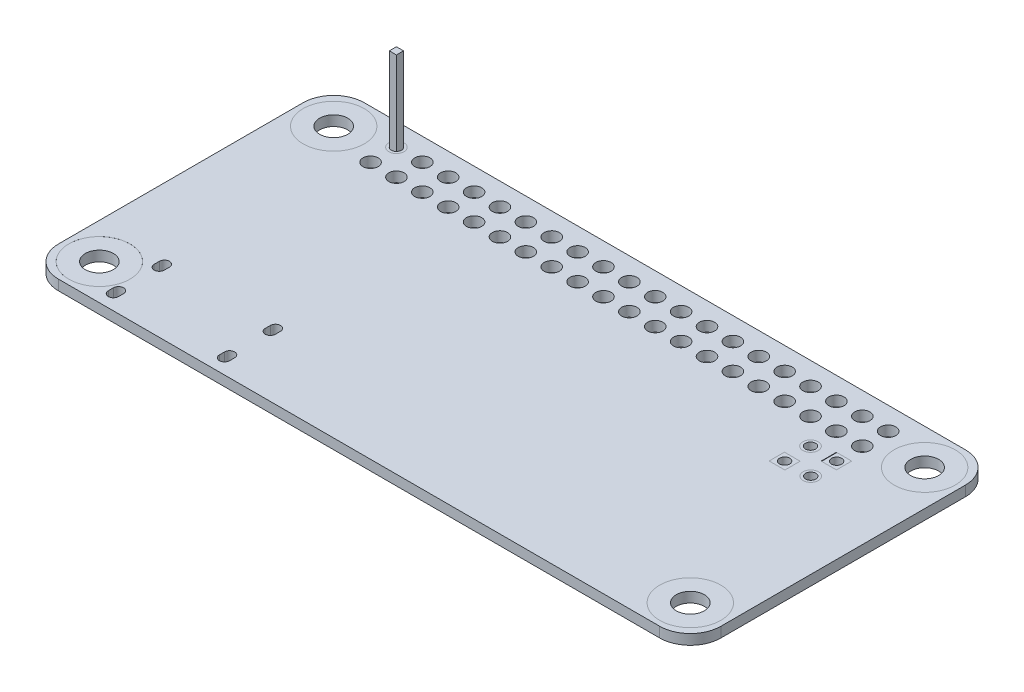
from build123d import *

# Parameters (mm, degrees)
SKETCH1_R                = 3
SKETCH1_R_2              = 0.75
SKETCH1_W                = 1.5
SKETCH1_H                = 1.5
BOSS_EXTRUDE1_DEPTH      = 1
SKETCH2_R                = 0.75
SKETCH2_R_2              = 0.5
BOSS_EXTRUDE2_DEPTH      = 1
BOSS_EXTRUDE5_DEPTH      = 8.2
BOSS_EXTRUDE5_DEPTH_BACK = 3
SKETCH6_W                = 0.7
SKETCH6_H                = 0.7
SKETCH3_R                = 0.75
SKETCH3_R_2              = 0.5
BOSS_EXTRUDE3_DEPTH      = 1
BOSS_EXTRUDE3_2_DEPTH    = 1
SKETCH3_W                = 1.541222488
SKETCH3_H                = 1.5
BOSS_EXTRUDE3_3_DEPTH    = 1
SKETCH3_W_2              = 1.458777511
BOSS_EXTRUDE3_4_DEPTH    = 1
SKETCH4_R                = 3
SKETCH4_R_2              = 1.375
BOSS_EXTRUDE4_DEPTH      = 1
CUT_EXTRUDE1_DEPTH       = 1


with BuildPart() as part:
    # Sketch1 → Boss-Extrude1 (new body)
    with BuildSketch(Plane(origin=(0, 0, 0), x_dir=(1, 0, 0), z_dir=(0, 1, 0))):
        with BuildLine():
            Line((-29.5, -15), (29.5, -15))
            ThreePointArc((29.5, -15), (31.621320344, -14.121320344), (32.5, -12))
            Line((32.5, -12), (32.5, 12))
            ThreePointArc((32.5, 12), (31.621320344, 14.121320344), (29.5, 15))
            Line((29.5, 15), (-29.5, 15))
            ThreePointArc((-29.5, 15), (-31.621320344, 14.121320344), (-32.5, 12))
            Line((-32.5, 12), (-32.5, -12))
            ThreePointArc((-32.5, -12), (-31.621320344, -14.121320344), (-29.5, -15))
        make_face()
        with Locations((-29, 11.5)):
            Circle(SKETCH1_R, mode=Mode.SUBTRACT)
        with Locations((-29, -11.5)):
            Circle(SKETCH1_R, mode=Mode.SUBTRACT)
        with Locations((29, -11.5)):
            Circle(SKETCH1_R, mode=Mode.SUBTRACT)
        with Locations((-24.13, 12.787653136)):
            Circle(SKETCH1_R_2, mode=Mode.SUBTRACT)
        with Locations((-21.59, 12.787653136)):
            Circle(SKETCH1_R_2, mode=Mode.SUBTRACT)
        with Locations((-19.05, 12.787653136)):
            Circle(SKETCH1_R_2, mode=Mode.SUBTRACT)
        with Locations((-16.51, 12.787653136)):
            Circle(SKETCH1_R_2, mode=Mode.SUBTRACT)
        with Locations((-13.97, 12.787653136)):
            Circle(SKETCH1_R_2, mode=Mode.SUBTRACT)
        with Locations((-11.43, 12.787653136)):
            Circle(SKETCH1_R_2, mode=Mode.SUBTRACT)
        with Locations((-8.89, 12.787653136)):
            Circle(SKETCH1_R_2, mode=Mode.SUBTRACT)
        with Locations((-6.35, 12.787653136)):
            Circle(SKETCH1_R_2, mode=Mode.SUBTRACT)
        with Locations((-3.81, 12.787653136)):
            Circle(SKETCH1_R_2, mode=Mode.SUBTRACT)
        with Locations((-1.27, 12.787653136)):
            Circle(SKETCH1_R_2, mode=Mode.SUBTRACT)
        with Locations((1.27, 12.787653136)):
            Circle(SKETCH1_R_2, mode=Mode.SUBTRACT)
        with Locations((3.81, 12.787653136)):
            Circle(SKETCH1_R_2, mode=Mode.SUBTRACT)
        with Locations((6.35, 12.787653136)):
            Circle(SKETCH1_R_2, mode=Mode.SUBTRACT)
        with Locations((8.89, 12.787653136)):
            Circle(SKETCH1_R_2, mode=Mode.SUBTRACT)
        with Locations((11.43, 12.787653136)):
            Circle(SKETCH1_R_2, mode=Mode.SUBTRACT)
        with Locations((13.97, 12.787653136)):
            Circle(SKETCH1_R_2, mode=Mode.SUBTRACT)
        with Locations((16.51, 12.787653136)):
            Circle(SKETCH1_R_2, mode=Mode.SUBTRACT)
        with Locations((19.05, 12.787653136)):
            Circle(SKETCH1_R_2, mode=Mode.SUBTRACT)
        with Locations((21.59, 12.787653136)):
            Circle(SKETCH1_R_2, mode=Mode.SUBTRACT)
        with Locations((24.13, 12.787653136)):
            Circle(SKETCH1_R_2, mode=Mode.SUBTRACT)
        with Locations((-21.59, 10.247653136)):
            Circle(SKETCH1_R_2, mode=Mode.SUBTRACT)
        with Locations((-19.05, 10.247653136)):
            Circle(SKETCH1_R_2, mode=Mode.SUBTRACT)
        with Locations((-16.51, 10.247653136)):
            Circle(SKETCH1_R_2, mode=Mode.SUBTRACT)
        with Locations((-13.97, 10.247653136)):
            Circle(SKETCH1_R_2, mode=Mode.SUBTRACT)
        with Locations((-11.43, 10.247653136)):
            Circle(SKETCH1_R_2, mode=Mode.SUBTRACT)
        with Locations((-8.89, 10.247653136)):
            Circle(SKETCH1_R_2, mode=Mode.SUBTRACT)
        with Locations((-6.35, 10.247653136)):
            Circle(SKETCH1_R_2, mode=Mode.SUBTRACT)
        with Locations((-3.81, 10.247653136)):
            Circle(SKETCH1_R_2, mode=Mode.SUBTRACT)
        with Locations((-1.27, 10.247653136)):
            Circle(SKETCH1_R_2, mode=Mode.SUBTRACT)
        with Locations((1.27, 10.247653136)):
            Circle(SKETCH1_R_2, mode=Mode.SUBTRACT)
        with Locations((3.81, 10.247653136)):
            Circle(SKETCH1_R_2, mode=Mode.SUBTRACT)
        with Locations((6.35, 10.247653136)):
            Circle(SKETCH1_R_2, mode=Mode.SUBTRACT)
        with Locations((8.89, 10.247653136)):
            Circle(SKETCH1_R_2, mode=Mode.SUBTRACT)
        with Locations((11.43, 10.247653136)):
            Circle(SKETCH1_R_2, mode=Mode.SUBTRACT)
        with Locations((13.97, 10.247653136)):
            Circle(SKETCH1_R_2, mode=Mode.SUBTRACT)
        with Locations((16.51, 10.247653136)):
            Circle(SKETCH1_R_2, mode=Mode.SUBTRACT)
        with Locations((19.05, 10.247653136)):
            Circle(SKETCH1_R_2, mode=Mode.SUBTRACT)
        with Locations((21.59, 10.247653136)):
            Circle(SKETCH1_R_2, mode=Mode.SUBTRACT)
        with Locations((24.13, 10.247653136)):
            Circle(SKETCH1_R_2, mode=Mode.SUBTRACT)
        with Locations((-24.13, 10.247653136)):
            Circle(SKETCH1_R_2, mode=Mode.SUBTRACT)
        with Locations((21.59002512, 7.707653136)):
            Circle(SKETCH1_R_2, mode=Mode.SUBTRACT)
        with Locations((24.150636364, 5.167736764)):
            Circle(SKETCH1_R_2, mode=Mode.SUBTRACT)
        with Locations((29, 11.5)):
            Circle(SKETCH1_R, mode=Mode.SUBTRACT)
        with Locations((24.13002512, 7.707653136)):
            Rectangle(SKETCH1_W, SKETCH1_H, mode=Mode.SUBTRACT)
        with Locations((21.610636364, 5.167736764)):
            Rectangle(SKETCH1_W, SKETCH1_H, mode=Mode.SUBTRACT)
    extrude(amount=BOSS_EXTRUDE1_DEPTH)

    # Sketch5 → Cut-Extrude1 (cut)
    with BuildSketch(Plane.XZ):
        with BuildLine():
            Line((-26.078842351, 13.039495396), (-26.078842351, 13.539495396))
            ThreePointArc((-26.078842351, 13.539495396), (-25.578842351, 14.039495396), (-25.078842351, 13.539495396))
            Line((-25.078842351, 13.539495396), (-25.078842351, 13.039495396))
            ThreePointArc((-25.078842351, 13.039495396), (-25.578842351, 12.539495396), (-26.078842351, 13.039495396))
        make_face()
        with BuildLine():
            Line((-15.178842351, 13.039495396), (-15.178842351, 13.539495396))
            ThreePointArc((-15.178842351, 13.539495396), (-14.678842351, 14.039495396), (-14.178842351, 13.539495396))
            Line((-14.178842351, 13.539495396), (-14.178842351, 13.039495396))
            ThreePointArc((-14.178842351, 13.039495396), (-14.678842351, 12.539495396), (-15.178842351, 13.039495396))
        make_face()
        with BuildLine():
            Line((-15.178842351, 8.539495396), (-15.178842351, 9.039495396))
            ThreePointArc((-15.178842351, 9.039495396), (-14.678842351, 9.539495396), (-14.178842351, 9.039495396))
            Line((-14.178842351, 9.039495396), (-14.178842351, 8.539495396))
            ThreePointArc((-14.178842351, 8.539495396), (-14.678842351, 8.039495396), (-15.178842351, 8.539495396))
        make_face()
        with BuildLine():
            Line((-26.078842351, 8.539495396), (-26.078842351, 9.039495396))
            ThreePointArc((-26.078842351, 9.039495396), (-25.578842351, 9.539495396), (-25.078842351, 9.039495396))
            Line((-25.078842351, 9.039495396), (-25.078842351, 8.539495396))
            ThreePointArc((-25.078842351, 8.539495396), (-25.578842351, 8.039495396), (-26.078842351, 8.539495396))
        make_face()
    extrude(amount=-CUT_EXTRUDE1_DEPTH, mode=Mode.SUBTRACT)


with BuildPart() as body_2:
    # Sketch2 → Boss-Extrude2 (new body)
    with BuildSketch(Plane(origin=(0, 0, 0), x_dir=(1, 0, 0), z_dir=(0, 1, 0))):
        with Locations((-24.13, 12.787653136)):
            Circle(SKETCH2_R)
        with Locations((-24.13, 12.787653136)):
            Circle(SKETCH2_R_2, mode=Mode.SUBTRACT)
    extrude(amount=BOSS_EXTRUDE2_DEPTH)


with BuildPart() as body_3:
    # Sketch6 → Boss-Extrude5 (new, two sides: drawn at the far end of the back side and taken through both)
    with BuildSketch(Plane(origin=(0, 1, 0), x_dir=(1, 0, 0), z_dir=(0, 1, 0)).offset(-BOSS_EXTRUDE5_DEPTH_BACK)):
        with Locations((-24.13, 12.787653136)):
            Rectangle(SKETCH6_W, SKETCH6_H)
    extrude(amount=BOSS_EXTRUDE5_DEPTH + BOSS_EXTRUDE5_DEPTH_BACK)


with BuildPart() as body_4:
    # Sketch3 → Boss-Extrude3 (new body)
    with BuildSketch(Plane(origin=(0, 0, 0), x_dir=(1, 0, 0), z_dir=(0, 1, 0))):
        with Locations((21.59002512, 7.707653136)):
            Circle(SKETCH3_R)
        with Locations((21.59002512, 7.707653136)):
            Circle(SKETCH3_R_2, mode=Mode.SUBTRACT)
    extrude(amount=BOSS_EXTRUDE3_DEPTH)


with BuildPart() as body_5:
    # Sketch3 → Boss-Extrude3 2 (new body)
    with BuildSketch(Plane(origin=(0, 0, 0), x_dir=(1, 0, 0), z_dir=(0, 1, 0))):
        with Locations((24.150636364, 5.167736764)):
            Circle(SKETCH3_R)
        with Locations((24.150636364, 5.167736764)):
            Circle(SKETCH3_R_2, mode=Mode.SUBTRACT)
    extrude(amount=BOSS_EXTRUDE3_2_DEPTH)


with BuildPart() as body_6:
    # Sketch3 → Boss-Extrude3 3 (new body)
    with BuildSketch(Plane(origin=(0, 0, 0), x_dir=(1, 0, 0), z_dir=(0, 1, 0))):
        with Locations((21.59002512, 5.167736764)):
            Rectangle(SKETCH3_W, SKETCH3_H)
        with Locations((21.59002512, 5.167736764)):
            Circle(SKETCH3_R_2, mode=Mode.SUBTRACT)
    extrude(amount=BOSS_EXTRUDE3_3_DEPTH)


with BuildPart() as body_7:
    # Sketch3 → Boss-Extrude3 4 (new body)
    with BuildSketch(Plane(origin=(0, 0, 0), x_dir=(1, 0, 0), z_dir=(0, 1, 0))):
        with Locations((24.150636365, 7.707653136)):
            Rectangle(SKETCH3_W_2, SKETCH3_H)
        with Locations((24.150636364, 7.707653136)):
            Circle(SKETCH3_R_2, mode=Mode.SUBTRACT)
    extrude(amount=BOSS_EXTRUDE3_4_DEPTH)


with BuildPart() as body_8:
    # Sketch4 → Boss-Extrude4 (new body)
    with BuildSketch(Plane(origin=(0, 0, 0), x_dir=(1, 0, 0), z_dir=(0, 1, 0))):
        with Locations((-29, 11.5)):
            Circle(SKETCH4_R)
        with Locations((-29, 11.5)):
            Circle(SKETCH4_R_2, mode=Mode.SUBTRACT)
    extrude(amount=BOSS_EXTRUDE4_DEPTH)


with BuildPart() as body_9:
    # Mirror1: mirrored copy
    add(body_8.part.mirror(Plane(origin=(0, 0, 0), x_dir=(0, 0, 1), z_dir=(1, 0, 0))))


with BuildPart() as body_10:
    # Mirror2: mirrored copy
    add(body_8.part.mirror(Plane.XY))


with BuildPart() as body_11:
    # Mirror2 2: mirrored copy
    add(body_9.part.mirror(Plane.XY))


solid = Compound([part.part, body_2.part, body_3.part, body_4.part, body_5.part, body_6.part, body_7.part, body_8.part, body_9.part, body_10.part, body_11.part])
